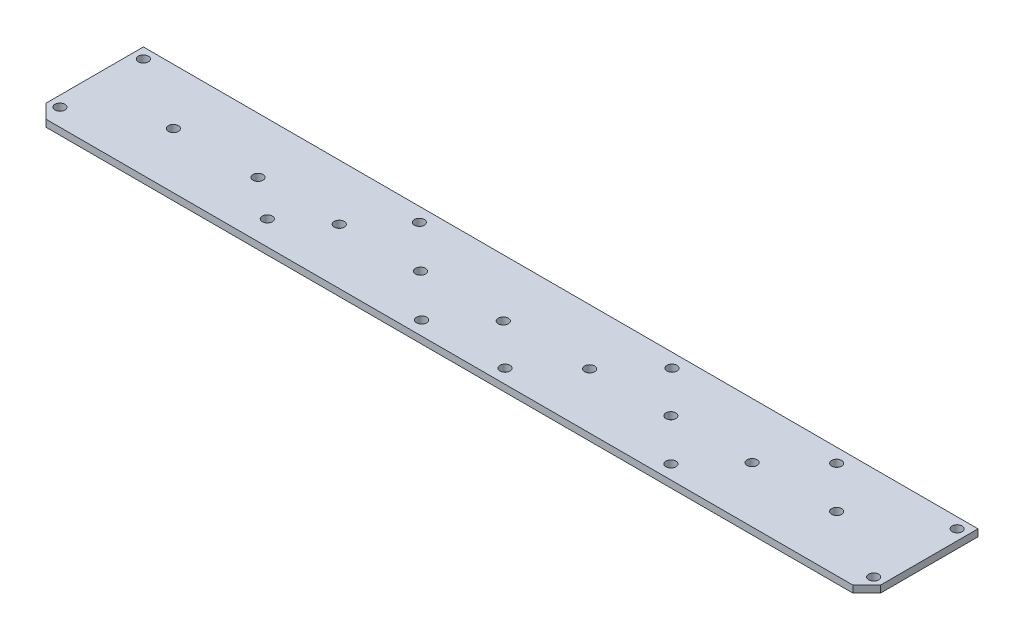
from build123d import *

# Parameters (mm, degrees)
SKETCH2_W           = 381
SKETCH2_H           = 50.8
BOSS_EXTRUDE1_DEPTH = 3.175
SKETCH3_R           = 2.286
CUT_EXTRUDE1_DEPTH  = 385.384860036


with BuildPart() as part:
    # Sketch2 → Boss-Extrude1 (new body)
    with BuildSketch(Plane(origin=(0, 0, 0), x_dir=(1, 0, 0), z_dir=(0, 1, 0))):
        with Locations((190.5, 25.4)):
            Rectangle(SKETCH2_W, SKETCH2_H)
    extrude(amount=BOSS_EXTRUDE1_DEPTH)

    # Sketch3 → Cut-Extrude1 (cut, through all)
    with BuildSketch(Plane(origin=(0, 0, 0), x_dir=(1, 0, 0), z_dir=(0, 1, 0))):
        with Locations((96.266, 11.1125)):
            Circle(SKETCH3_R)
        with Locations((285.242, 6.35)):
            Circle(SKETCH3_R)
        with Locations((322.834, 44.45)):
            Circle(SKETCH3_R)
        with Locations((132.334, 44.45)):
            Circle(SKETCH3_R)
        with Locations((247.65, 44.45)):
            Circle(SKETCH3_R)
        with Locations((209.55, 6.35)):
            Circle(SKETCH3_R)
        with Locations((171.45, 6.35)):
            Circle(SKETCH3_R)
        with Locations((4.7625, 7.9375)):
            Circle(SKETCH3_R)
        with Locations((4.7625, 46.0375)):
            Circle(SKETCH3_R)
        with Locations((39.116, 25.4)):
            Circle(SKETCH3_R)
        with Locations((77.724, 25.4)):
            Circle(SKETCH3_R)
        with Locations((114.808, 25.4)):
            Circle(SKETCH3_R)
        with Locations((190.5, 24.60625)):
            Circle(SKETCH3_R)
        with Locations((341.884, 25.4)):
            Circle(SKETCH3_R)
        with Locations((376.2375, 7.9375)):
            Circle(SKETCH3_R)
        with Locations((376.2375, 46.0375)):
            Circle(SKETCH3_R)
        with Locations((303.276, 25.4)):
            Circle(SKETCH3_R)
        with Locations((266.192, 25.4)):
            Circle(SKETCH3_R)
        with Locations((229.108, 25.4)):
            Circle(SKETCH3_R)
        with Locations((151.892, 25.4)):
            Circle(SKETCH3_R)
        Polygon((0, 6.35), (6.35, 0), (0, 0), align=None)
        Polygon((374.65, 0), (381, 6.35), (381, 0), align=None)
    extrude(amount=CUT_EXTRUDE1_DEPTH, mode=Mode.SUBTRACT)


solid = part.part
